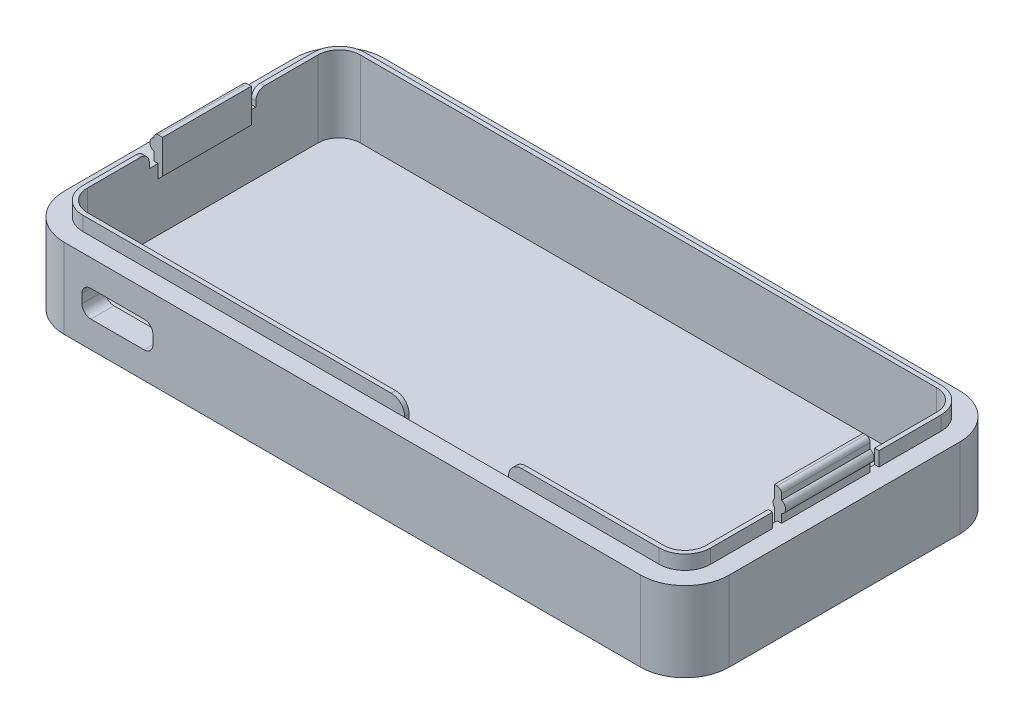
from build123d import *

# Parameters (mm, degrees)
EXTRUDE_2_DEPTH       = 9
EXTRUDE_4_DEPTH       = 1.6
SKETCH_7_W            = 0.5
SKETCH_7_H            = 10
EXTRUDE_8_DEPTH       = 2.8
SKETCH_8_R            = 0.7
EXTRUDE_9_DEPTH       = 10
FILLET_1_R            = 0.5
SKETCH_11_W           = 1
SKETCH_11_H           = 1.6
CUT_EXTRUDE_1_DEPTH   = 1.2
FILLET_2_R            = 1
SKETCH_13_W           = 0.5
SKETCH_13_H           = 10
EXTRUDE_10_DEPTH      = 2.8
CUT_EXTRUDE_START     = -7
CUT_EXTRUDE_2_DEPTH   = 7
SKETCH_13_2_W         = 0.5
SKETCH_13_2_H         = 10
EXTRUDE_11_DEPTH      = 2
EXTRUDE_12_DEPTH      = 1.6
EXTRUDE_12_DEPTH_BACK = 2
SKETCH_5_W            = 0.3
SKETCH_5_H            = 10
SKETCH_17_W           = 0.5
SKETCH_17_H           = 1
CUT_EXTRUDE_3_DEPTH   = 1.6
SKETCH_19_W           = 0.8
SKETCH_19_H           = 10
EXTRUDE_15_DEPTH      = 1.8
SKETCH_20_R           = 0.7
EXTRUDE_16_DEPTH      = 10
FILLET_4_R            = 0.5
CUT_EXTRUDE_START_2   = -0.5
CUT_EXTRUDE_14_DEPTH  = 0.5
CUT_EXTRUDE_15_REACH  = 46.744
SKETCH_38_W           = 2.5
SKETCH_38_H           = 10
FILLET_18_R           = 1
CUT_EXTRUDE_START_3   = -0.8
CUT_EXTRUDE_16_DEPTH  = 0.8
SKETCH_41_W           = 12
SKETCH_41_H           = 2.5
CUT_EXTRUDE_17_DEPTH  = 1
CHAMFER_1_SIZE        = 1
CUT_EXTRUDE_START_4   = -8.6
SKETCH_42_W           = 11.71
SKETCH_42_H           = 0.5
CUT_EXTRUDE_18_DEPTH  = 8.6
FILLET_20_R           = 1.5
CHAMFER_2_SIZE        = 1
CHAMFER_3_SIZE        = 1
CUT_EXTRUDE_19_REACH  = 56.535
SKETCH_43_W           = 8
SKETCH_43_H           = 3
FILLET_22_R           = 1


# Read off the part's stored shape, not the designer's step: 切除-拉伸14, 切除-拉伸16
# Some blends are built 0.0001 mm under size
with BuildPart() as part:
    # case 2 → 凸台-拉伸2 (new body)
    with BuildSketch(Plane(origin=(0, 0, 0), x_dir=(1, 0, 0), z_dir=(0, 1, 0))):
        with BuildLine():
            Line((-34.042196447, 18), (30.957803553, 18))
            ThreePointArc((30.957803553, 18), (34.493337459, 16.535533906), (35.957803553, 13))
            Line((35.957803553, 13), (35.957803553, -13))
            ThreePointArc((35.957803553, -13), (34.493337459, -16.535533906), (30.957803553, -18))
            Line((30.957803553, -18), (-34.042196447, -18))
            ThreePointArc((-34.042196447, -18), (-37.577730353, -16.535533906), (-39.042196447, -13))
            Line((-39.042196447, -13), (-39.042196447, 13))
            ThreePointArc((-39.042196447, 13), (-37.577730353, 16.535533906), (-34.042196447, 18))
        make_face()
    extrude(amount=EXTRUDE_2_DEPTH)

    # 草图3 → 凸台-拉伸4 (add)
    with BuildSketch(Plane(origin=(0, 9, 0), x_dir=(1, 0, 0), z_dir=(0, 1, 0))):
        with BuildLine():
            Line((-36.942196447, 13), (-36.942196447, -13))
            ThreePointArc((-36.942196447, -13), (-36.092806113, -15.050609665), (-34.042196447, -15.9))
            Line((-34.042196447, -15.9), (30.957803553, -15.9))
            ThreePointArc((30.957803553, -15.9), (33.008413218, -15.050609665), (33.857803553, -13))
            Line((33.857803553, -13), (33.857803553, 13))
            ThreePointArc((33.857803553, 13), (33.008413218, 15.050609665), (30.957803553, 15.9))
            Line((30.957803553, 15.9), (-34.042196447, 15.9))
            ThreePointArc((-34.042196447, 15.9), (-36.092806113, 15.050609665), (-36.942196447, 13))
        make_face()
        with BuildLine():
            Line((-34.042196447, -15.4), (30.957803553, -15.4))
            ThreePointArc((30.957803553, -15.4), (32.654859828, -14.697056275), (33.357803553, -13))
            Line((33.357803553, -13), (33.357803553, 13))
            ThreePointArc((33.357803553, 13), (32.654859828, 14.697056275), (30.957803553, 15.4))
            Line((30.957803553, 15.4), (-34.042196447, 15.4))
            ThreePointArc((-34.042196447, 15.4), (-35.739252722, 14.697056275), (-36.442196447, 13))
            Line((-36.442196447, 13), (-36.442196447, -13))
            ThreePointArc((-36.442196447, -13), (-35.739252722, -14.697056275), (-34.042196447, -15.4))
        make_face(mode=Mode.SUBTRACT)
    extrude(amount=EXTRUDE_4_DEPTH)

    # 草图7 → 凸台-拉伸8 (add)
    with BuildSketch(Plane(origin=(0, 9, 0), x_dir=(1, 0, 0), z_dir=(0, 1, 0))):
        with Locations((-36.692196447, 0)):
            Rectangle(SKETCH_7_W, SKETCH_7_H)
    extrude(amount=EXTRUDE_8_DEPTH)

    # 草图8 → 凸台-拉伸9 (add)
    with BuildSketch(Plane.XY.offset(5)):
        with Locations((-36.692196447, 10.6)):
            Circle(SKETCH_8_R)
    extrude(amount=-EXTRUDE_9_DEPTH)

    # 圆角1
    fillet_1_edges = [part.edges().sort_by_distance(p)[0] for p in [
        (-36.942196447, 11.8, 0),
    ]]
    fillet(fillet_1_edges, radius=FILLET_1_R - 0.0001)  # a hair under: the kernel refuses the full size

    # 草图11 → 切除-拉伸1 (cut)
    with BuildSketch(Plane.ZY.offset(36.942196447)):
        with Locations((5.5, 9.8)):
            Rectangle(SKETCH_11_W, SKETCH_11_H)
        with Locations((-5.5, 9.8)):
            Rectangle(SKETCH_11_W, SKETCH_11_H)
    extrude(amount=-CUT_EXTRUDE_1_DEPTH, mode=Mode.SUBTRACT)

    # 圆角2
    fillet_2_edges = [part.edges().sort_by_distance(p)[0] for p in [
        (-36.692196447, 10.6, 6),
        (-36.692196447, 10.6, -6),
    ]]
    fillet(fillet_2_edges, radius=FILLET_2_R)

    # 草图13 → 凸台-拉伸10 (add)
    with BuildSketch(Plane(origin=(0, 9, 0), x_dir=(1, 0, 0), z_dir=(0, 1, 0))):
        with Locations((-36.192196447, 0)):
            Rectangle(SKETCH_13_W, SKETCH_13_H)
    extrude(amount=EXTRUDE_10_DEPTH)

    # 草图14 → 切除-拉伸2 (cut)
    with BuildSketch(Plane(origin=(0, 9, 0), x_dir=(1, 0, 0), z_dir=(0, 1, 0)).offset(CUT_EXTRUDE_START)):
        with BuildLine():
            Line((-34.042196447, -15.4), (30.957803553, -15.4))
            ThreePointArc((30.957803553, -15.4), (32.654859828, -14.697056275), (33.357803553, -13))
            Line((33.357803553, -13), (33.357803553, 13))
            ThreePointArc((33.357803553, 13), (32.654859828, 14.697056275), (30.957803553, 15.4))
            Line((30.957803553, 15.4), (-34.042196447, 15.4))
            ThreePointArc((-34.042196447, 15.4), (-35.739252722, 14.697056275), (-36.442196447, 13))
            Line((-36.442196447, 13), (-36.442196447, -13))
            ThreePointArc((-36.442196447, -13), (-35.739252722, -14.697056275), (-34.042196447, -15.4))
        make_face()
    extrude(amount=CUT_EXTRUDE_2_DEPTH, mode=Mode.SUBTRACT)

    # 草图13<2> → 凸台-拉伸11 (add)
    with BuildSketch(Plane(origin=(0, 9, 0), x_dir=(1, 0, 0), z_dir=(0, 1, 0))):
        with Locations((-36.192196447, 0)):
            Rectangle(SKETCH_13_2_W, SKETCH_13_2_H)
    extrude(amount=-EXTRUDE_11_DEPTH)

    # 草图5 → 凸台-拉伸12 (add, two sides: drawn at the far end of the back side and taken through both)
    with BuildSketch(Plane(origin=(0, 9, 0), x_dir=(1, 0, 0), z_dir=(0, 1, 0)).offset(-EXTRUDE_12_DEPTH_BACK)):
        with Locations((33.207803553, 0)):
            Rectangle(SKETCH_5_W, SKETCH_5_H)
    extrude(amount=EXTRUDE_12_DEPTH + EXTRUDE_12_DEPTH_BACK)

    # 草图17 → 切除-拉伸3 (cut)
    with BuildSketch(Plane(origin=(0, 10.6, 0), x_dir=(1, 0, 0), z_dir=(0, 1, 0))):
        with Locations((33.607803553, -5.5)):
            Rectangle(SKETCH_17_W, SKETCH_17_H)
        with Locations((33.607803553, 5.5)):
            Rectangle(SKETCH_17_W, SKETCH_17_H)
    extrude(amount=-CUT_EXTRUDE_3_DEPTH, mode=Mode.SUBTRACT)

    # 草图19 → 凸台-拉伸15 (add)
    with BuildSketch(Plane(origin=(0, 10.6, 0), x_dir=(1, 0, 0), z_dir=(0, 1, 0))):
        with Locations((33.457803553, 0)):
            Rectangle(SKETCH_19_W, SKETCH_19_H)
    extrude(amount=EXTRUDE_15_DEPTH)

    # 草图20 → 凸台-拉伸16 (add)
    with BuildSketch(Plane(origin=(0, 0, -5), x_dir=(-1, 0, 0), z_dir=(0, 0, -1))):
        with Locations((-33.607803553, 10.6)):
            Circle(SKETCH_20_R)
    extrude(amount=-EXTRUDE_16_DEPTH)

    # 圆角4
    fillet_4_edges = [part.edges().sort_by_distance(p)[0] for p in [
        (33.857803553, 12.4, 0),
    ]]
    fillet(fillet_4_edges, radius=FILLET_4_R)

    # 切除-拉伸14 outline → 切除-拉伸14 (cut)
    with BuildSketch(Plane.XZ.offset(CUT_EXTRUDE_START_2)):
        with BuildLine():
            Line((-32.307197099, 14.675448373), (-32.594748949, 14.84319914))
            add(Edge.make_bspline(
                [(-32.594748949, 14.84319914), (-32.688625023, 14.895110099), (-32.79244694, 14.923070591), (-33.000139527, 14.923070591), (-33.103985821, 14.895110099), (-33.197837519, 14.84319914)],
                knots=[3, 3, 3, 3, 4, 4, 5, 5, 5, 5], degree=3))
            Line((-33.197837519, 14.84319914), (-33.485413746, 14.675448373))
            Line((-33.485413746, 14.675448373), (-34.977143816, 13.814755176))
            Line((-34.977143816, 13.814755176), (-35.264720043, 13.649003328))
            add(Edge.make_bspline(
                [(-35.264720043, 13.649003328), (-35.450424518, 13.541171384), (-35.566264327, 13.341474474), (-35.566264327, 13.127797317)],
                knots=[8, 8, 8, 8, 9, 9, 9, 9], degree=3))
            Line((-35.566264327, 13.127797317), (-35.566264327, 10.739417881))
            add(Edge.make_bspline(
                [(-35.566264327, 10.739417881), (-35.566264327, 10.523753994), (-35.450424518, 10.326043814), (-35.264720043, 10.21821187)],
                knots=[10, 10, 10, 10, 11, 11, 11, 11], degree=3))
            Line((-35.264720043, 10.21821187), (-34.977143816, 10.052460022))
            Line((-34.977143816, 10.052460022), (-33.485413746, 9.191766826))
            Line((-33.485413746, 9.191766826), (-33.197837519, 9.024028247))
            add(Edge.make_bspline(
                [(-33.197837519, 9.024028247), (-33.103985821, 8.97010618), (-33.000139527, 8.944144607), (-32.79244694, 8.944144607), (-32.688625023, 8.97010618), (-32.594748949, 9.024028247)],
                knots=[14, 14, 14, 14, 15, 15, 16, 16, 16, 16], degree=3))
            Line((-32.594748949, 9.024028247), (-32.307197099, 9.191766826))
            Line((-32.307197099, 9.191766826), (-30.815467029, 10.052460022))
            Line((-30.815467029, 10.052460022), (-30.527915179, 10.21821187))
            add(Edge.make_bspline(
                [(-30.527915179, 10.21821187), (-30.340187407, 10.326043814), (-30.226370894, 10.523753994), (-30.226370894, 10.739417881)],
                knots=[19, 19, 19, 19, 20, 20, 20, 20], degree=3))
            Line((-30.226370894, 10.739417881), (-30.226370894, 13.127797317))
            add(Edge.make_bspline(
                [(-30.226370894, 13.127797317), (-30.226370894, 13.341474474), (-30.340187407, 13.541171384), (-30.527915179, 13.649003328)],
                knots=[21, 21, 21, 21, 22, 22, 22, 22], degree=3))
            Line((-30.527915179, 13.649003328), (-30.815467029, 13.814755176))
            Line((-30.815467029, 13.814755176), (-32.307197099, 14.675448373))
        make_face()
        with BuildLine():
            add(Edge.make_bspline(
                [(-32.171416851, 10.645566184), (-31.943735071, 10.773375132), (-31.835915316, 10.941113711), (-31.835915316, 11.326527285), (-31.959726425, 11.324528366), (-32.18338599, 11.196731607)],
                knots=[0, 0, 0, 0, 1, 1, 2.031545133, 2.031545133, 2.031545133, 2.031545133], degree=3))
            Line((-32.18338599, 11.196731607), (-32.355122407, 11.100868801))
            add(Edge.make_bspline(
                [(-32.3751116, 11.066923739), (-32.3751116, 11.080903986), (-32.367115923, 11.094884232), (-32.355122407, 11.100868801)],
                knots=[4, 4, 4, 4, 5, 5, 5, 5], degree=3))
            Line((-32.3751116, 11.066923739), (-32.3751116, 9.541236419))
            add(Edge.make_bspline(
                [(-32.395052038, 9.507291357), (-32.381083981, 9.515274845), (-32.3751116, 9.527256173), (-32.3751116, 9.541236419)],
                knots=[3, 3, 3, 3, 4, 4, 4, 4], degree=3))
            Line((-32.395052038, 9.507291357), (-32.782476721, 9.287629631))
            add(Edge.make_bspline(
                [(-32.840396625, 9.321574693), (-32.840396625, 9.291615281), (-32.808438294, 9.273649385), (-32.782476721, 9.287629631)],
                knots=[5, 5, 5, 5, 6, 6, 6, 6], degree=3))
            Line((-32.840396625, 9.321574693), (-32.840396625, 11.170770033))
            add(Edge.make_bspline(
                [(-32.82043181, 11.204715095), (-32.834399868, 11.198730526), (-32.840396625, 11.18475028), (-32.840396625, 11.170770033)],
                knots=[7, 7, 7, 7, 8, 8, 8, 8], degree=3))
            Line((-32.82043181, 11.204715095), (-32.161422255, 11.578147342))
            add(Edge.make_bspline(
                [(-32.161422255, 11.578147342), (-31.734067941, 11.819784992), (-31.380624887, 11.8677103), (-31.380624887, 10.927133464), (-31.73806578, 10.521755074), (-32.14742982, 10.290099833)],
                knots=[9, 9, 9, 9, 10, 10, 10.962489192, 10.962489192, 10.962489192, 10.962489192], degree=3))
            Line((-32.14742982, 10.290099833), (-32.355122407, 10.174284401))
            Line((-32.355122407, 10.174284401), (-32.355122407, 10.553701217))
            Line((-32.355122407, 10.553701217), (-32.171416851, 10.645566184))
        make_face(mode=Mode.SUBTRACT)
        with BuildLine():
            add(Edge.make_bspline(
                [(-30.779535236, 10.413910942), (-30.767541721, 10.4199077), (-30.759546043, 10.433887946), (-30.759546043, 10.447868193)],
                knots=[0, 0, 0, 0, 1, 1, 1, 1], degree=3))
            Line((-30.779535236, 10.413910942), (-31.162937703, 10.196248135))
            add(Edge.make_bspline(
                [(-31.220857607, 10.230193197), (-31.220857607, 10.200245974), (-31.188899276, 10.182267889), (-31.162937703, 10.196248135)],
                knots=[2, 2, 2, 2, 3, 3, 3, 3], degree=3))
            Line((-31.220857607, 10.230193197), (-31.220857607, 11.110863398))
            add(Edge.make_bspline(
                [(-31.200868415, 11.14480846), (-31.21286193, 11.136824971), (-31.220857607, 11.124831456), (-31.220857607, 11.110863398)],
                knots=[4, 4, 4, 4, 5, 5, 5, 5], degree=3))
            Line((-31.200868415, 11.14480846), (-30.817465948, 11.360484536))
            add(Edge.make_bspline(
                [(-30.759546043, 11.326527285), (-30.759546043, 11.356486697), (-30.791504375, 11.374452594), (-30.817465948, 11.360484536)],
                knots=[6, 6, 6, 6, 7, 7, 7, 7], degree=3))
            Line((-30.759546043, 11.326527285), (-30.759546043, 10.447868193))
        make_face(mode=Mode.SUBTRACT)
        with BuildLine():
            add(Edge.make_bspline(
                [(-30.989202366, 11.945595021), (-31.144947429, 11.857727892), (-31.254790481, 11.697972802), (-31.254790481, 11.556183608), (-31.254790481, 11.418392252), (-31.144947429, 11.380449351), (-30.989202366, 11.470315399)],
                knots=[0, 0, 0, 0, 1, 1, 1, 2, 2, 2, 2], degree=3))
            add(Edge.make_bspline(
                [(-30.989202366, 11.470315399), (-30.835431845, 11.556183608), (-30.72561317, 11.717937617), (-30.72561317, 11.855728973), (-30.72561317, 11.995519248), (-30.835431845, 12.033462149), (-30.989202366, 11.945595021)],
                knots=[2, 2, 2, 2, 3, 3, 3, 4, 4, 4, 4], degree=3))
        make_face(mode=Mode.SUBTRACT)
        with BuildLine():
            add(Edge.make_bspline(
                [(-33.090017763, 12.097366623), (-32.970204493, 12.027465391), (-32.82043181, 12.027465391), (-32.700594162, 12.097366623)],
                knots=[7, 7, 7, 7, 8, 8, 8, 8], degree=3))
            add(Edge.make_bspline(
                [(-34.899259095, 13.141777563), (-34.895261257, 13.139778644), (-33.090017763, 12.097366623)],
                knots=[0, 0, 0, 1, 1, 1], degree=2))
            add(Edge.make_bspline(
                [(-34.881293199, 13.411363517), (-34.983140573, 13.353455801), (-34.993110793, 13.209667687), (-34.899259095, 13.141777563)],
                knots=[1, 1, 1, 1, 2, 2, 2, 2], degree=3))
            Line((-34.881293199, 13.411363517), (-33.036095697, 14.477750381))
            add(Edge.make_bspline(
                [(-32.754516228, 14.477750381), (-32.842371168, 14.527674609), (-32.9502153, 14.527674609), (-33.036095697, 14.477750381)],
                knots=[3, 3, 3, 3, 4, 4, 4, 4], degree=3))
            Line((-32.754516228, 14.477750381), (-30.919313323, 13.409364598))
            add(Edge.make_bspline(
                [(-30.917314403, 13.163741298), (-30.823462706, 13.219662284), (-30.825461625, 13.35545472), (-30.919313323, 13.409364598)],
                knots=[5, 5, 5, 5, 6, 6, 6, 6], degree=3))
            Line((-30.917314403, 13.163741298), (-32.700594162, 12.097366623))
        make_face(mode=Mode.SUBTRACT)
    extrude(amount=CUT_EXTRUDE_14_DEPTH, mode=Mode.SUBTRACT)

    # 草图38 → 切除-拉伸15 (cut, up to next)
    with BuildSketch(Plane.XZ, mode=Mode.PRIVATE) as cut_extrude_15_sk1:
        with Locations((27.207803553, 3.6)):
            Rectangle(SKETCH_38_W, SKETCH_38_H)
    cut_extrude_15_tool1 = extrude(cut_extrude_15_sk1.sketch, amount=-CUT_EXTRUDE_15_REACH, mode=Mode.PRIVATE) & part.part
    add(cut_extrude_15_tool1.solids().sort_by_distance((27.207804, 0, 3.6))[0], mode=Mode.SUBTRACT)

    # 圆角18
    fillet_18_edges = [part.edges().sort_by_distance(p)[0] for p in [
        (25.957803553, 1, -1.4),
        (25.957803553, 1, 8.6),
        (28.457803553, 1, 8.6),
        (28.457803553, 1, -1.4),
    ]]
    fillet(fillet_18_edges, radius=FILLET_18_R)

    # 切除-拉伸16 outline → 切除-拉伸16 (cut)
    # profile 1 of 6: a face of its own
    with BuildSketch(Plane.XZ.offset(CUT_EXTRUDE_START_3)):
        with BuildLine():
            add(Edge.make_bspline(
                [(19.453750743, -1.912106671), (19.408626688, -1.837205095), (19.3226733, -1.694530767), (19.189351817, -1.497044322), (19.062037133, -1.322205475), (18.929006182, -1.177253367), (18.793632748, -1.058525893), (18.650273603, -0.971877654), (18.496975316, -0.914139653), (18.389535951, -0.907549351), (18.334959625, -0.904201654)],
                knots=[0, 0, 0, 0, 0.166616267, 0.317374686, 0.454054005, 0.578317085, 0.691671191, 0.795890415, 0.896317786, 1, 1, 1, 1], degree=3))
            Line((19.453750743, -1.912106671), (20.706598194, -3.97591218))
            Line((20.706598194, -3.97591218), (22.778678786, -3.97591218))
            Line((22.778678786, -3.97591218), (21.272613819, -1.602618595))
            add(Edge.make_bspline(
                [(20.049556664, -0.387836522), (20.109180426, -0.409814254), (20.231919783, -0.455056831), (20.398935513, -0.569984004), (20.563120733, -0.705433976), (20.719485229, -0.864678299), (20.872107895, -1.037685995), (21.013119781, -1.224103366), (21.148123756, -1.412095672), (21.231682149, -1.539975672), (21.272613819, -1.602618595)],
                knots=[0, 0, 0, 0, 0.108308314, 0.222959649, 0.344272461, 0.472394006, 0.604137966, 0.73872092, 0.872010593, 1, 1, 1, 1], degree=3))
            Line((20.049556664, -0.387836522), (20.049556664, -0.364666292))
            add(Edge.make_bspline(
                [(21.871729773, 1.87953601), (21.870268009, 1.810484594), (21.867393162, 1.674681318), (21.840845046, 1.475081852), (21.803180699, 1.282701712), (21.743434924, 1.100232639), (21.672375764, 0.925860433), (21.588497434, 0.759428496), (21.487438375, 0.603366714), (21.375640897, 0.454206279), (21.249841171, 0.315173522), (21.110887609, 0.187514359), (20.961953153, 0.067227759), (20.799350394, -0.040714963), (20.627520003, -0.141643447), (20.442894597, -0.225798751), (20.250810182, -0.303739614), (20.117221267, -0.344181783), (20.049556664, -0.364666292)],
                knots=[0, 0, 0, 0, 0.066352771, 0.130495854, 0.193325077, 0.254551022, 0.314731918, 0.374271311, 0.433419609, 0.493248882, 0.55333153, 0.613381394, 0.674513074, 0.737180896, 0.800864009, 0.865878345, 0.932065558, 1, 1, 1, 1], degree=3))
            add(Edge.make_bspline(
                [(18.930765546, 4.07408782), (19.04943327, 4.072777878), (19.279362367, 4.070239753), (19.613061788, 4.042802364), (19.923867428, 4.001052236), (20.212027804, 3.941339524), (20.477685717, 3.866250583), (20.7209192, 3.772321498), (20.939747323, 3.65896073), (21.138447386, 3.532070275), (21.310309078, 3.383347068), (21.462068742, 3.220228509), (21.587956404, 3.037751198), (21.693006817, 2.839728707), (21.775154654, 2.62423158), (21.82954954, 2.390883704), (21.865830648, 2.141057167), (21.869723183, 1.96849256), (21.871729773, 1.87953601)],
                knots=[0, 0, 0, 0, 0.085072713, 0.164835824, 0.239912713, 0.309814075, 0.375670734, 0.437670893, 0.496408874, 0.552146374, 0.606294627, 0.65892908, 0.711493621, 0.764757564, 0.819344749, 0.876335745, 0.936251438, 1, 1, 1, 1], degree=3))
            Line((18.930765546, 4.07408782), (16.046071878, 4.07408782))
            Line((16.046071878, 4.07408782), (16.046071878, -3.97591218))
            Line((16.046071878, -3.97591218), (17.846729773, -3.97591218))
            Line((17.846729773, -3.97591218), (17.846729773, -0.904201654))
            Line((17.846729773, -0.904201654), (18.334959625, -0.904201654))
        make_face()
        with BuildLine():
            add(Edge.make_bspline(
                [(19.965150826, 1.649488724), (19.964287054, 1.692015608), (19.962621054, 1.774039413), (19.947275664, 1.893169162), (19.922728467, 2.004063449), (19.88856531, 2.107964345), (19.84118655, 2.202048953), (19.786974253, 2.290043975), (19.719759478, 2.367157573), (19.644787213, 2.438454903), (19.558144221, 2.498709007), (19.462675528, 2.552874065), (19.356780077, 2.596697117), (19.240931563, 2.633068913), (19.115614863, 2.663510957), (18.979146456, 2.681655533), (18.833436843, 2.696381391), (18.732758819, 2.696864887), (18.680858062, 2.697114135)],
                knots=[0, 0, 0, 0, 0.06726802, 0.129743318, 0.189678709, 0.246821831, 0.302259206, 0.35602177, 0.409897607, 0.463631815, 0.519343431, 0.576406483, 0.637043414, 0.700264404, 0.76844385, 0.840788046, 0.917924284, 1, 1, 1, 1], degree=3))
            add(Edge.make_bspline(
                [(19.599392191, 0.807085353), (19.62870731, 0.835740339), (19.686386241, 0.892120426), (19.760972971, 0.985618626), (19.824453598, 1.083644127), (19.875975888, 1.186902673), (19.916478366, 1.295571734), (19.943261329, 1.409664154), (19.963390074, 1.527971034), (19.964558002, 1.608575183), (19.965150826, 1.649488724)],
                knots=[0, 0, 0, 0, 0.129841783, 0.25547006, 0.37819239, 0.499410405, 0.620577955, 0.744847917, 0.870488364, 1, 1, 1, 1], degree=3))
            add(Edge.make_bspline(
                [(18.646102717, 0.47277203), (18.694718433, 0.473452473), (18.789492398, 0.474778963), (18.926978181, 0.492972005), (19.058351241, 0.51617529), (19.180779959, 0.555029499), (19.297606264, 0.601477703), (19.406152472, 0.659434771), (19.508243413, 0.726999278), (19.569063028, 0.780437232), (19.599392191, 0.807085353)],
                knots=[0, 0, 0, 0, 0.140812703, 0.274507487, 0.401531903, 0.526986243, 0.646071424, 0.765542549, 0.883082156, 1, 1, 1, 1], degree=3))
            Line((18.646102717, 0.47277203), (17.846729773, 0.47277203))
            Line((17.846729773, 0.47277203), (17.846729773, 2.697114135))
            Line((17.846729773, 2.697114135), (18.680858062, 2.697114135))
        make_face(mode=Mode.SUBTRACT)
    # profile 2 of 6: a face of its own
    with BuildSketch(Plane.XZ.offset(CUT_EXTRUDE_START_3)):
        with BuildLine():
            add(Edge.make_bspline(
                [(10.429939066, -1.528142855), (10.451295182, -1.601278344), (10.49261868, -1.742793504), (10.537005219, -1.951127732), (10.574595885, -2.144973098), (10.586444944, -2.270562263), (10.592130677, -2.330825832)],
                knots=[0, 0, 0, 0, 0.278523147, 0.538934631, 0.778759223, 1, 1, 1, 1], degree=3))
            Line((10.429939066, -1.528142855), (8.761682487, 4.07408782))
            Line((8.761682487, 4.07408782), (6.820348194, 4.07408782))
            Line((6.820348194, 4.07408782), (9.54285025, -3.97591218))
            Line((9.54285025, -3.97591218), (11.585140546, -3.97591218))
            Line((11.585140546, -3.97591218), (14.340742931, 4.07408782))
            Line((14.340742931, 4.07408782), (12.455679197, 4.07408782))
            Line((12.455679197, 4.07408782), (10.797352717, -1.504972624))
            add(Edge.make_bspline(
                [(10.625231006, -2.330825832), (10.633557107, -2.266759575), (10.650697754, -2.134868659), (10.687023234, -1.932469546), (10.737325316, -1.721360827), (10.777033033, -1.578221503), (10.797352717, -1.504972624)],
                knots=[0, 0, 0, 0, 0.229460129, 0.47238138, 0.730001014, 1, 1, 1, 1], degree=3))
            Line((10.625231006, -2.330825832), (10.592130677, -2.330825832))
        make_face()
    # profile 3 of 6: a face of its own
    with BuildSketch(Plane.XZ.offset(CUT_EXTRUDE_START_3)):
        with BuildLine():
            add(Edge.make_bspline(
                [(-4.29606628, -1.077978381), (-4.386240829, -1.139963849), (-4.564361791, -1.262403176), (-4.820910542, -1.447782618), (-5.061983626, -1.626283061), (-5.270626633, -1.80757474), (-5.448285183, -1.982390917), (-5.565539728, -2.131441654), (-5.63550229, -2.248290911), (-5.672270691, -2.330830604), (-5.695967807, -2.412262983), (-5.698348758, -2.466387319), (-5.699520227, -2.493017444)],
                knots=[0, 0, 0, 0, 0.160375386, 0.316788032, 0.463954722, 0.599810878, 0.721597888, 0.828827593, 0.87667161, 0.920841975, 0.96105286, 1, 1, 1, 1], degree=3))
            add(Edge.make_bspline(
                [(-2.20412549, 1.902706241), (-2.206632827, 1.813268111), (-2.211539516, 1.638243765), (-2.241549406, 1.382741781), (-2.29915397, 1.143225582), (-2.375134127, 0.918226229), (-2.471419434, 0.707688776), (-2.578797651, 0.505474347), (-2.702914965, 0.314407131), (-2.841233239, 0.132856587), (-2.99286902, -0.038455326), (-3.152949336, -0.205468379), (-3.327523339, -0.361805392), (-3.573516223, -0.56226615), (-3.896204906, -0.802329399), (-4.161996479, -0.985555841), (-4.29606628, -1.077978381)],
                knots=[0, 0, 0, 0, 0.070274231, 0.137521897, 0.201645623, 0.263456112, 0.32378572, 0.383312987, 0.443178485, 0.502554106, 0.562444697, 0.622822543, 0.684189306, 0.746395083, 0.872077357, 1, 1, 1, 1], degree=3))
            add(Edge.make_bspline(
                [(-4.814086428, 4.180008872), (-4.714717599, 4.178137725), (-4.52047952, 4.174480159), (-4.236919041, 4.144943992), (-3.96981552, 4.093247238), (-3.718877496, 4.024073607), (-3.484768325, 3.936725062), (-3.269046988, 3.830876772), (-3.072173291, 3.707684129), (-2.893952886, 3.568006708), (-2.734099195, 3.411977353), (-2.594386151, 3.239375894), (-2.476232202, 3.049840011), (-2.376899103, 2.846526703), (-2.298433735, 2.628576589), (-2.244897722, 2.397426076), (-2.210676499, 2.154183409), (-2.206341725, 1.987782044), (-2.20412549, 1.902706241)],
                knots=[0, 0, 0, 0, 0.076136194, 0.14882482, 0.218136801, 0.284394431, 0.348073216, 0.409328816, 0.468210251, 0.52571743, 0.582516363, 0.639031411, 0.695448344, 0.753302534, 0.812138424, 0.872533151, 0.934830194, 1, 1, 1, 1], degree=3))
            add(Edge.make_bspline(
                [(-7.182414964, 3.504762162), (-7.094397472, 3.55913713), (-6.919233522, 3.667348965), (-6.643064594, 3.804029703), (-6.359061196, 3.921078067), (-6.065839338, 4.014304829), (-5.764841663, 4.090106154), (-5.455483879, 4.14213107), (-5.137527931, 4.174910243), (-4.922847322, 4.1782944), (-4.814086428, 4.180008872)],
                knots=[0, 0, 0, 0, 0.124218059, 0.247206838, 0.369651686, 0.492877681, 0.616473746, 0.742195786, 0.869391945, 1, 1, 1, 1], degree=3))
            Line((-7.182414964, 3.504762162), (-7.182414964, 1.955666767))
            add(Edge.make_bspline(
                [(-5.191430178, 2.803035188), (-5.277641628, 2.800478402), (-5.450418891, 2.795354321), (-5.707745626, 2.753970091), (-5.962244907, 2.687723655), (-6.213583546, 2.593784383), (-6.462373281, 2.474273741), (-6.707771483, 2.327423734), (-6.950619363, 2.155196694), (-7.104007546, 2.023159965), (-7.182414964, 1.955666767)],
                knots=[0, 0, 0, 0, 0.11678746, 0.234054964, 0.352290892, 0.472700507, 0.597099173, 0.725834873, 0.859855048, 1, 1, 1, 1], degree=3))
            add(Edge.make_bspline(
                [(-4.004783385, 1.73058453), (-4.00787234, 1.814196612), (-4.013717532, 1.972414772), (-4.067994493, 2.194524314), (-4.162081675, 2.382834234), (-4.270811599, 2.513063078), (-4.375657743, 2.596677934), (-4.462797781, 2.65313569), (-4.560771287, 2.699978546), (-4.668086783, 2.737274321), (-4.785410783, 2.76733663), (-4.912150993, 2.788713818), (-5.048914243, 2.799503233), (-5.142867235, 2.801831658), (-5.191430178, 2.803035188)],
                knots=[0, 0, 0, 0, 0.136703988, 0.258683353, 0.370941413, 0.47857603, 0.533149274, 0.590005303, 0.648158595, 0.710415069, 0.775676489, 0.846186152, 0.920495846, 1, 1, 1, 1], degree=3))
            add(Edge.make_bspline(
                [(-5.452922776, -0.161099269), (-5.340303876, -0.079758268), (-5.126827575, 0.074428783), (-4.831583775, 0.307887757), (-4.581931222, 0.538008389), (-4.373293368, 0.765340646), (-4.207911905, 0.993614332), (-4.089223538, 1.229189526), (-4.018085197, 1.475993387), (-4.009246061, 1.645170772), (-4.004783385, 1.73058453)],
                knots=[0, 0, 0, 0, 0.168174123, 0.318784766, 0.455361744, 0.578769898, 0.691808674, 0.795448475, 0.896726655, 1, 1, 1, 1], degree=3))
            add(Edge.make_bspline(
                [(-7.606099174, -3.35197098), (-7.603757793, -3.252513944), (-7.599185383, -3.05828737), (-7.557593724, -2.77524541), (-7.494773936, -2.506537721), (-7.400446052, -2.254839212), (-7.285905671, -2.018618273), (-7.162973017, -1.792163988), (-7.02342757, -1.580060177), (-6.869872424, -1.381565945), (-6.708279475, -1.192893521), (-6.537451949, -1.016202668), (-6.360457387, -0.849406568), (-6.115497605, -0.649349394), (-5.813933259, -0.418738824), (-5.570329869, -0.24488828), (-5.452922776, -0.161099269)],
                knots=[0, 0, 0, 0, 0.074122296, 0.144751143, 0.212899553, 0.279538751, 0.344679238, 0.408571093, 0.471554573, 0.533759381, 0.595604021, 0.656702572, 0.716951784, 0.776840371, 0.892445983, 1, 1, 1, 1], degree=3))
            Line((-7.606099174, -3.35197098), (-7.606099174, -3.97591218))
            Line((-7.606099174, -3.97591218), (-2.20412549, -3.97591218))
            Line((-2.20412549, -3.97591218), (-2.20412549, -2.493017444))
            Line((-2.20412549, -2.493017444), (-5.699520227, -2.493017444))
        make_face()
    # profile 4 of 6: a face of its own
    with BuildSketch(Plane.XZ.offset(CUT_EXTRUDE_START_3)):
        with BuildLine():
            add(Edge.make_bspline(
                [(-21.807464306, 4.07408782), (-21.700411461, 4.072273409), (-21.492705146, 4.068753049), (-21.1902882, 4.048074119), (-20.907390312, 4.009829633), (-20.643097787, 3.958245784), (-20.399124119, 3.887605292), (-20.172332116, 3.806019345), (-19.964982926, 3.706681304), (-19.777275736, 3.592093379), (-19.609033024, 3.465339536), (-19.463995885, 3.323950407), (-19.341743436, 3.169488846), (-19.240023849, 3.003841692), (-19.161177357, 2.824628087), (-19.107464489, 2.6328745), (-19.073238861, 2.429115454), (-19.068954575, 2.289018323), (-19.066757069, 2.217159366)],
                knots=[0, 0, 0, 0, 0.086111784, 0.167076003, 0.243636736, 0.315604137, 0.383442271, 0.447738418, 0.509263166, 0.568013132, 0.624368313, 0.67833919, 0.730452185, 0.782428986, 0.834286324, 0.887374422, 0.942231817, 1, 1, 1, 1], degree=3))
            Line((-21.807464306, 4.07408782), (-24.680572859, 4.07408782))
            Line((-24.680572859, 4.07408782), (-24.680572859, -3.97591218))
            Line((-24.680572859, -3.97591218), (-21.645272694, -3.97591218))
            add(Edge.make_bspline(
                [(-18.748993911, -1.541382986), (-18.750995702, -1.632531664), (-18.754907105, -1.810631795), (-18.791966083, -2.070327872), (-18.853642413, -2.315272976), (-18.937591351, -2.54677609), (-19.047584627, -2.763533023), (-19.182698958, -2.964712983), (-19.341615005, -3.151620185), (-19.523294633, -3.323568675), (-19.727199911, -3.476579421), (-19.948262225, -3.612098441), (-20.188523625, -3.724277219), (-20.445433965, -3.817206181), (-20.720451908, -3.887972535), (-21.012652507, -3.938617103), (-21.322917591, -3.971061295), (-21.535957954, -3.974267183), (-21.645272694, -3.97591218)],
                knots=[0, 0, 0, 0, 0.063980294, 0.125014415, 0.183740077, 0.241100441, 0.297582768, 0.353993304, 0.41088997, 0.46953635, 0.52927556, 0.589604776, 0.651299274, 0.71514689, 0.781204705, 0.850438617, 0.923257435, 1, 1, 1, 1], degree=3))
            add(Edge.make_bspline(
                [(-20.602612332, 0.403261339), (-20.533969606, 0.393465564), (-20.398920041, 0.374193089), (-20.203611963, 0.324531222), (-20.017785627, 0.265954594), (-19.842722246, 0.19334094), (-19.679590295, 0.104183495), (-19.526077262, 0.00372242), (-19.381978553, -0.10912544), (-19.252270984, -0.236687816), (-19.135053285, -0.373605893), (-19.031426257, -0.518366042), (-18.943597903, -0.670676268), (-18.871499401, -0.830761897), (-18.817557813, -0.99866678), (-18.777281995, -1.172947471), (-18.753981041, -1.354840198), (-18.750677007, -1.478427047), (-18.748993911, -1.541382986)],
                knots=[0, 0, 0, 0, 0.070303358, 0.138316736, 0.204165203, 0.2678883, 0.330249721, 0.392503034, 0.453869322, 0.515617324, 0.57675344, 0.636550183, 0.69597904, 0.754857078, 0.814330728, 0.874617959, 0.936129577, 1, 1, 1, 1], degree=3))
            Line((-20.602612332, 0.403261339), (-20.602612332, 0.42643157))
            add(Edge.make_bspline(
                [(-19.066757069, 2.217159366), (-19.068033626, 2.164695686), (-19.070555794, 2.061040059), (-19.090569922, 1.907350013), (-19.125917902, 1.759286418), (-19.171697187, 1.615140764), (-19.233763687, 1.477508055), (-19.309038428, 1.34438275), (-19.396203228, 1.215251128), (-19.53174463, 1.052108742), (-19.725258032, 0.867759852), (-19.988366035, 0.679931336), (-20.282197942, 0.528644065), (-20.494422373, 0.46094427), (-20.602612332, 0.42643157)],
                knots=[0, 0, 0, 0, 0.06200521, 0.122507397, 0.182773666, 0.241752556, 0.301011975, 0.36086759, 0.422363197, 0.48490106, 0.611275607, 0.73703793, 0.865944483, 1, 1, 1, 1], degree=3))
        make_face()
        with BuildLine():
            add(Edge.make_bspline(
                [(-20.655572859, -1.51159269), (-20.656318619, -1.472354923), (-20.657775285, -1.395713192), (-20.675194627, -1.284341918), (-20.701314333, -1.179415193), (-20.738021864, -1.081214577), (-20.784179275, -0.988875001), (-20.84354314, -0.904448417), (-20.910618404, -0.823943031), (-21.019077123, -0.729213163), (-21.175712489, -0.624415335), (-21.398482407, -0.5401753), (-21.652786859, -0.488043657), (-21.833108955, -0.483117436), (-21.928280507, -0.480517444)],
                knots=[0, 0, 0, 0, 0.063501449, 0.124035115, 0.182118418, 0.238386167, 0.293535902, 0.348808571, 0.405218052, 0.462804318, 0.581520604, 0.708296958, 0.8460431, 1, 1, 1, 1], degree=3))
            add(Edge.make_bspline(
                [(-21.939865622, -2.598938496), (-21.844701859, -2.595785845), (-21.663116528, -2.58977016), (-21.406901799, -2.535441798), (-21.182950193, -2.443782588), (-21.023150099, -2.336106852), (-20.916092443, -2.233330652), (-20.846150462, -2.150118729), (-20.786, -2.06059721), (-20.73769001, -1.963808617), (-20.701139661, -1.859701881), (-20.675410846, -1.749234732), (-20.657749602, -1.632418248), (-20.656309548, -1.55248445), (-20.655572859, -1.51159269)],
                knots=[0, 0, 0, 0, 0.149925312, 0.286077774, 0.410470854, 0.529419024, 0.587251437, 0.644054111, 0.700509365, 0.756917688, 0.814145061, 0.874065956, 0.935575879, 1, 1, 1, 1], degree=3))
            Line((-21.939865622, -2.598938496), (-22.879914964, -2.598938496))
            Line((-22.879914964, -2.598938496), (-22.879914964, -0.480517444))
            Line((-22.879914964, -0.480517444), (-21.928280507, -0.480517444))
        make_face(mode=Mode.SUBTRACT)
        with BuildLine():
            add(Edge.make_bspline(
                [(-20.973336017, 1.859675813), (-20.976583426, 1.925878834), (-20.982767714, 2.051954275), (-21.045435369, 2.227405429), (-21.146141372, 2.376656528), (-21.288613242, 2.498970982), (-21.472429543, 2.588634544), (-21.692599091, 2.651364749), (-21.950594468, 2.691096667), (-22.135546099, 2.695017348), (-22.234458549, 2.697114135)],
                knots=[0, 0, 0, 0, 0.115482616, 0.219922315, 0.321419458, 0.427510883, 0.544533228, 0.676506008, 0.826994855, 1, 1, 1, 1], degree=3))
            add(Edge.make_bspline(
                [(-22.121917431, 0.896456241), (-22.037258741, 0.899421144), (-21.87581989, 0.905075029), (-21.648003767, 0.953159592), (-21.447732222, 1.03242771), (-21.278315906, 1.145911713), (-21.142305304, 1.288383832), (-21.040829186, 1.455875636), (-20.98437819, 1.65096489), (-20.977119885, 1.788155949), (-20.973336017, 1.859675813)],
                knots=[0, 0, 0, 0, 0.149921494, 0.285890953, 0.410451161, 0.52950521, 0.644311574, 0.756999804, 0.873320163, 1, 1, 1, 1], degree=3))
            Line((-22.121917431, 0.896456241), (-22.879914964, 0.896456241))
            Line((-22.879914964, 0.896456241), (-22.879914964, 2.697114135))
            Line((-22.879914964, 2.697114135), (-22.234458549, 2.697114135))
        make_face(mode=Mode.SUBTRACT)
    # profile 5 of 6: a face of its own
    with BuildSketch(Plane.XZ.offset(CUT_EXTRUDE_START_3)):
        Polygon((1.725545562, -3.97591218), (3.526203457, -3.97591218), (3.526203457, 2.591193083), (5.856466615, 2.591193083), (5.856466615, 4.07408782), (-0.498796543, 4.07408782), (-0.498796543, 2.591193083), (1.725545562, 2.591193083), align=None)
    # profile 6 of 6: a face of its own
    with BuildSketch(Plane.XZ.offset(CUT_EXTRUDE_START_3)):
        Polygon((-11.535770227, -3.97591218), (-9.735112332, -3.97591218), (-9.735112332, 4.07408782), (-11.535770227, 4.07408782), (-11.535770227, 0.896456241), (-14.819322859, 0.896456241), (-14.819322859, 4.07408782), (-16.619980753, 4.07408782), (-16.619980753, -3.97591218), (-14.819322859, -3.97591218), (-14.819322859, -0.692359549), (-11.535770227, -0.692359549), align=None)
    extrude(amount=CUT_EXTRUDE_16_DEPTH, mode=Mode.SUBTRACT)

    # 草图41 → 切除-拉伸17 (cut)
    with BuildSketch(Plane(origin=(0, 2, 0), x_dir=(1, 0, 0), z_dir=(0, 1, 0))):
        with Locations((-7.542196447, -12.92)):
            Rectangle(SKETCH_41_W, SKETCH_41_H)
    extrude(amount=-CUT_EXTRUDE_17_DEPTH, mode=Mode.SUBTRACT)

    # 倒角1
    # the kernel refuses this chamfer: 1 mm, written as the material it takes off along each edge
    with BuildSketch(Plane(origin=(33.057803553, 7, 7.571682988), x_dir=(0.9996219169112968, -0.027495876610586414, 0), z_dir=(0, 0, -1))) as chamfer_1_piece_1_section:
        Polygon((CHAMFER_1_SIZE * 0.999621916911, -CHAMFER_1_SIZE * 0.0274958766106), (-CHAMFER_1_SIZE * 0.0274958766106, -CHAMFER_1_SIZE * 0.999621916911), (0, 0), align=None)
    chamfer_1_piece_1 = extrude(amount=15.143365976, mode=Mode.PRIVATE)
    chamfer_1_piece_1 = split(chamfer_1_piece_1, bisect_by=Plane(origin=(33.357803553, 7.436497273, 0), z_dir=(-1, 0, 0)), keep=Keep.TOP, mode=Mode.PRIVATE)
    add(chamfer_1_piece_1, mode=Mode.SUBTRACT)
    with BuildSketch(Plane(origin=(-35.942196447, 7, 7.571682988), x_dir=(-0.9996219169112968, -0.027495876610586414, 0), z_dir=(0, 0, -1))) as chamfer_1_piece_2_section:
        Polygon((CHAMFER_1_SIZE * 0.999621916911, CHAMFER_1_SIZE * 0.0274958766106), (-CHAMFER_1_SIZE * 0.0274958766106, CHAMFER_1_SIZE * 0.999621916911), (0, 0), align=None)
    chamfer_1_piece_2 = extrude(amount=15.143365976, mode=Mode.PRIVATE)
    chamfer_1_piece_2 = split(chamfer_1_piece_2, bisect_by=Plane(origin=(-36.442196447, 7.393401084, 0), z_dir=(1, 0, 0)), keep=Keep.TOP, mode=Mode.PRIVATE)
    add(chamfer_1_piece_2, mode=Mode.SUBTRACT)

    # 草图42 → 切除-拉伸18 (cut)
    with BuildSketch(Plane(origin=(0, 10.6, 0), x_dir=(1, 0, 0), z_dir=(0, 1, 0)).offset(CUT_EXTRUDE_START_4)):
        with Locations((8.102803553, -15.65)):
            Rectangle(SKETCH_42_W, SKETCH_42_H)
    extrude(amount=CUT_EXTRUDE_18_DEPTH, mode=Mode.SUBTRACT)

    # 圆角20
    fillet_20_edges = [part.edges().sort_by_distance(p)[0] for p in [
        (13.957803553, 10.6, 15.65),
        (2.247803553, 10.6, 15.65),
    ]]
    fillet(fillet_20_edges, radius=FILLET_20_R)

    # 倒角2
    chamfer_2_edges = [part.edges().sort_by_distance(p)[0] for p in [
        (-7.542196447, 1, 11.67),
    ]]
    chamfer(chamfer_2_edges, length=CHAMFER_2_SIZE - 0.0001)  # a hair under: the kernel refuses the full size

    # 倒角3
    # the kernel refuses this chamfer: 1 mm, written as the material it takes off along each edge
    with BuildSketch(Plane(origin=(-13.542196447, 2, 14.17), x_dir=(0.027495876610585623, -0.9996219169112968, 0), z_dir=(0, 0, -1))) as chamfer_3_piece_1_section:
        Polygon((CHAMFER_3_SIZE * 0.999621916911, CHAMFER_3_SIZE * 0.0274958766106), (-CHAMFER_3_SIZE * 0.0274958766106, CHAMFER_3_SIZE * 0.999621916911), (0, 0), align=None)
    chamfer_3_piece_1 = extrude(amount=2.5, mode=Mode.PRIVATE)
    chamfer_3_piece_1 = split(chamfer_3_piece_1, bisect_by=Plane(origin=(-13.887960992, 1.149936284, 12.519963716), z_dir=(0, 0.7071067811865476, 0.7071067811865475)), keep=Keep.TOP, mode=Mode.PRIVATE)
    chamfer_3_piece_1 = split(chamfer_3_piece_1, bisect_by=Plane(origin=(-13.887960992, 1, 13.070225624), z_dir=(0, 1, 0)), keep=Keep.TOP, mode=Mode.PRIVATE)
    add(chamfer_3_piece_1, mode=Mode.SUBTRACT)
    with BuildSketch(Plane(origin=(-1.542196447, 2, 14.17), x_dir=(0, 0.027495876610587375, 0.9996219169112968), z_dir=(-1, 0, 0))) as chamfer_3_piece_2_section:
        Polygon((CHAMFER_3_SIZE * 0.999621916911, -CHAMFER_3_SIZE * 0.0274958766106), (-CHAMFER_3_SIZE * 0.0274958766106, -CHAMFER_3_SIZE * 0.999621916911), (0, 0), align=None)
    chamfer_3_piece_2 = extrude(amount=12, mode=Mode.PRIVATE)
    chamfer_3_piece_2 = split(chamfer_3_piece_2, bisect_by=Plane(origin=(-7.542196447, 1, 14.500404154), z_dir=(0, 1, 0)), keep=Keep.TOP, mode=Mode.PRIVATE)
    add(chamfer_3_piece_2, mode=Mode.SUBTRACT)
    with BuildSketch(Plane(origin=(-1.542196447, 2, 11.67), x_dir=(0.9996219169112968, 0.02749587661058735, 0), z_dir=(0, 0, 1))) as chamfer_3_piece_3_section:
        Polygon((CHAMFER_3_SIZE * 0.999621916911, -CHAMFER_3_SIZE * 0.0274958766106), (-CHAMFER_3_SIZE * 0.0274958766106, -CHAMFER_3_SIZE * 0.999621916911), (0, 0), align=None)
    chamfer_3_piece_3 = extrude(amount=2.5, mode=Mode.PRIVATE)
    chamfer_3_piece_3 = split(chamfer_3_piece_3, bisect_by=Plane(origin=(-1.196431903, 1.149936284, 12.519963716), z_dir=(0, 0.7071067811865476, 0.7071067811865475)), keep=Keep.TOP, mode=Mode.PRIVATE)
    chamfer_3_piece_3 = split(chamfer_3_piece_3, bisect_by=Plane(origin=(-1.196431903, 1, 13.070225624), z_dir=(0, 1, 0)), keep=Keep.TOP, mode=Mode.PRIVATE)
    add(chamfer_3_piece_3, mode=Mode.SUBTRACT)
    with BuildSketch(Plane(origin=(-13.542196447, 2, 16.741682988), x_dir=(0.027495876610585623, -0.9996219169112968, 0), z_dir=(0, 0, -1))) as chamfer_3_piece_4a_section:
        Polygon((CHAMFER_3_SIZE * 0.999621916911, CHAMFER_3_SIZE * 0.0274958766106), (-CHAMFER_3_SIZE * 0.0274958766106, CHAMFER_3_SIZE * 0.999621916911), (0, 0), align=None)
    chamfer_3_piece_4a = extrude(amount=5.071682988, mode=Mode.PRIVATE)
    chamfer_3_piece_4a = split(chamfer_3_piece_4a, bisect_by=Plane(origin=(-13.872600602, 1, 14.785), z_dir=(0, 1, 0)), keep=Keep.TOP, mode=Mode.PRIVATE)
    chamfer_3_piece_4a = split(chamfer_3_piece_4a, bisect_by=Plane(origin=(-13.872600602, 1.671365666, 14.17), z_dir=(0, 0, 1)), keep=Keep.TOP, mode=Mode.PRIVATE)
    chamfer_3_piece_4a = split(chamfer_3_piece_4a, bisect_by=Plane(origin=(-13.872600602, 1.671365666, 15.4), z_dir=(0, 0, -1)), keep=Keep.TOP, mode=Mode.PRIVATE)
    with BuildSketch(Plane(origin=(-1.542196447, 2, 14.17), x_dir=(0, 0.027495876610587375, 0.9996219169112968), z_dir=(-1, 0, 0))) as chamfer_3_piece_4b_section:
        Polygon((CHAMFER_3_SIZE * 0.999621916911, -CHAMFER_3_SIZE * 0.0274958766106), (-CHAMFER_3_SIZE * 0.0274958766106, -CHAMFER_3_SIZE * 0.999621916911), (0, 0), align=None)
    chamfer_3_piece_4b = extrude(amount=14.571682988, mode=Mode.PRIVATE)
    chamfer_3_piece_4b = split(chamfer_3_piece_4b, bisect_by=Plane(origin=(-13.542196447, 1.671365666, 14.500404154), z_dir=(-1, 0, 0)), keep=Keep.TOP, mode=Mode.PRIVATE)
    chamfer_3_piece_4b = split(chamfer_3_piece_4b, bisect_by=Plane(origin=(-14.828037941, 1, 14.500404154), z_dir=(0, 1, 0)), keep=Keep.TOP, mode=Mode.PRIVATE)
    chamfer_3_piece_4 = chamfer_3_piece_4a & chamfer_3_piece_4b
    add(chamfer_3_piece_4, mode=Mode.SUBTRACT)
    with BuildSketch(Plane(origin=(-1.542196447, 2, 11.67), x_dir=(0.9996219169112968, 0.02749587661058735, 0), z_dir=(0, 0, 1))) as chamfer_3_piece_5a_section:
        Polygon((CHAMFER_3_SIZE * 0.999621916911, -CHAMFER_3_SIZE * 0.0274958766106), (-CHAMFER_3_SIZE * 0.0274958766106, -CHAMFER_3_SIZE * 0.999621916911), (0, 0), align=None)
    chamfer_3_piece_5a = extrude(amount=5.071682988, mode=Mode.PRIVATE)
    chamfer_3_piece_5a = split(chamfer_3_piece_5a, bisect_by=Plane(origin=(-1.211792293, 1.671365666, 15.4), z_dir=(0, 0, -1)), keep=Keep.TOP, mode=Mode.PRIVATE)
    chamfer_3_piece_5a = split(chamfer_3_piece_5a, bisect_by=Plane(origin=(-1.211792293, 1, 14.785), z_dir=(0, 1, 0)), keep=Keep.TOP, mode=Mode.PRIVATE)
    chamfer_3_piece_5a = split(chamfer_3_piece_5a, bisect_by=Plane(origin=(-1.211792293, 1.671365666, 14.17), z_dir=(0, 0, 1)), keep=Keep.TOP, mode=Mode.PRIVATE)
    with BuildSketch(Plane(origin=(1.029486541, 2, 14.17), x_dir=(0, 0.02749587661058651, 0.9996219169112968), z_dir=(-1, 0, 0))) as chamfer_3_piece_5b_section:
        Polygon((CHAMFER_3_SIZE * 0.999621916911, -CHAMFER_3_SIZE * 0.0274958766106), (-CHAMFER_3_SIZE * 0.0274958766106, -CHAMFER_3_SIZE * 0.999621916911), (0, 0), align=None)
    chamfer_3_piece_5b = extrude(amount=14.571682988, mode=Mode.PRIVATE)
    chamfer_3_piece_5b = split(chamfer_3_piece_5b, bisect_by=Plane(origin=(-0.256354953, 1, 14.500404154), z_dir=(0, 1, 0)), keep=Keep.TOP, mode=Mode.PRIVATE)
    chamfer_3_piece_5b = split(chamfer_3_piece_5b, bisect_by=Plane(origin=(-1.542196447, 1.671365666, 14.500404154), z_dir=(1, 0, 0)), keep=Keep.TOP, mode=Mode.PRIVATE)
    chamfer_3_piece_5 = chamfer_3_piece_5a & chamfer_3_piece_5b
    add(chamfer_3_piece_5, mode=Mode.SUBTRACT)

    # 草图43 → 切除-拉伸19 (cut, up to next)
    with BuildSketch(Plane.XY.offset(18), mode=Mode.PRIVATE) as cut_extrude_19_sk1:
        with Locations((-28.042196447, 4.5)):
            Rectangle(SKETCH_43_W, SKETCH_43_H)
    cut_extrude_19_tool1 = extrude(cut_extrude_19_sk1.sketch, amount=-CUT_EXTRUDE_19_REACH, mode=Mode.PRIVATE) & part.part
    add(cut_extrude_19_tool1.solids().sort_by_distance((-28.042196, 4.5, 18))[0], mode=Mode.SUBTRACT)

    # 圆角22
    fillet_22_edges = [part.edges().sort_by_distance(p)[0] for p in [
        (-24.042196447, 6, 16.7),
        (-24.042196447, 3, 16.7),
        (-32.042196447, 3, 16.7),
        (-32.042196447, 6, 16.7),
    ]]
    fillet(fillet_22_edges, radius=FILLET_22_R)


solid = part.part
